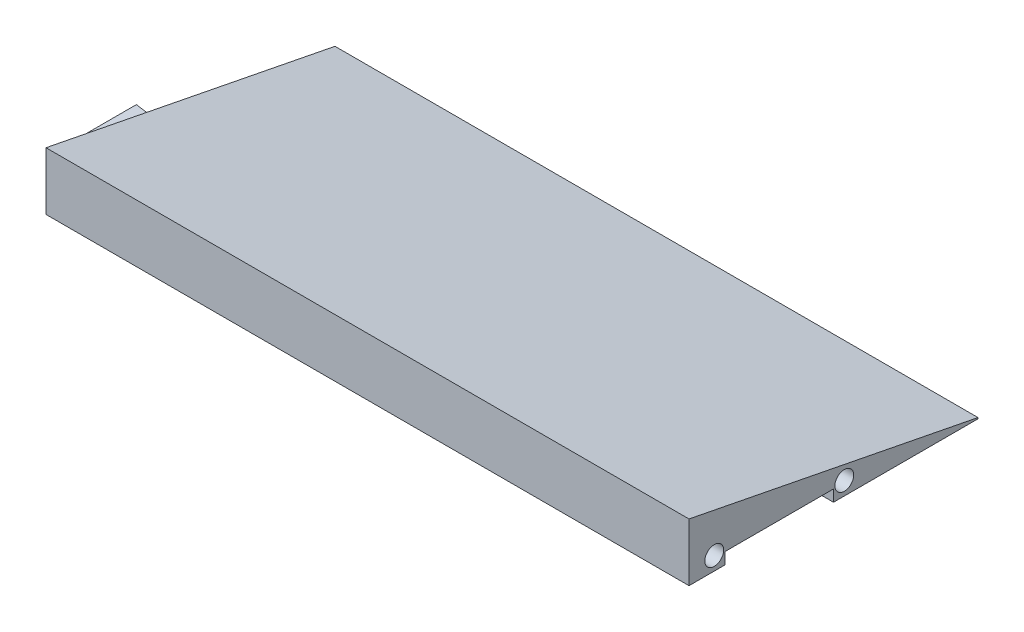
from build123d import *

# Parameters (mm, degrees)
BOSS_EXTRUDE1_DEPTH = 195.58
SKETCH2_R           = 3.3147
CUT_EXTRUDE1_DEPTH  = 38.1
SKETCH3_W           = 38.1
SKETCH3_H           = 4.064
CUT_EXTRUDE2_DEPTH  = 405.649982083
CUT_EXTRUDE3_DEPTH  = 4.064
SKETCH5_W           = 101.6
SKETCH5_H           = 20.32
CUT_EXTRUDE4_DEPTH  = 165.1
BOSS_EXTRUDE2_DEPTH = 4.064
SKETCH7_R           = 1.905
CUT_EXTRUDE5_DEPTH  = 12.7


with BuildPart() as part:
    # Sketch1 → Boss-Extrude1 (new, symmetric)
    with BuildSketch(Plane(origin=(0, 0, 0), x_dir=(0, 0, -1), z_dir=(1, 0, 0))):
        Polygon((0, 0), (0, 20.32), (101.6, 0.4), (101.6, 0), align=None)
    extrude(amount=BOSS_EXTRUDE1_DEPTH, both=True)

    # Sketch2 → Cut-Extrude1 (cut)
    with BuildSketch(Plane(origin=(195.58, 0, 0), x_dir=(0, 0, -1), z_dir=(1, 0, 0))):
        with Locations((8.876362872, 4.7625)):
            Circle(SKETCH2_R)
        with Locations((54.596362872, 4.7625)):
            Circle(SKETCH2_R)
    cut_extrude1 = extrude(amount=-CUT_EXTRUDE1_DEPTH, mode=Mode.SUBTRACT)

    # Mirror3: Cut-Extrude1 across plane
    add(cut_extrude1.mirror(Plane(origin=(0, 0, 0), x_dir=(0, 0, 1), z_dir=(1, 0, 0))), mode=Mode.SUBTRACT)

    # Sketch3 → Cut-Extrude2 (cut, through all)
    with BuildSketch(Plane.ZY.offset(195.58)):
        with Locations((-31.75, 2.032)):
            Rectangle(SKETCH3_W, SKETCH3_H)
    extrude(amount=-CUT_EXTRUDE2_DEPTH, mode=Mode.SUBTRACT)

    # Sketch4 → Cut-Extrude3 (cut)
    with BuildSketch(Plane.XZ):
        Polygon((-10.28091728, -50.8), (-11.606541067, -60.232303355), (-10.28091728, -60.232303355), (5.914635147, -60.232303355), (7.240258933, -60.232303355), (5.914635147, -50.8), align=None)
        Polygon((56.917835147, -50.8), (55.59221136, -60.232303355), (56.917835147, -60.232303355), (73.113387573, -60.232303355), (74.43901136, -60.232303355), (73.113387573, -50.8), align=None)
        Polygon((124.116587573, -50.8), (122.790963787, -60.232303355), (124.116587573, -60.232303355), (140.31214, -60.232303355), (141.637763787, -60.232303355), (140.31214, -50.8), align=None)
        Polygon((124.116587573, -12.7), (140.31214, -12.7), (141.637763787, -3.267696645), (140.31214, -3.267696645), (124.116587573, -3.267696645), (122.790963787, -3.267696645), align=None)
        Polygon((56.917835147, -12.7), (73.113387573, -12.7), (74.43901136, -3.267696645), (73.113387573, -3.267696645), (56.917835147, -3.267696645), (55.59221136, -3.267696645), align=None)
        Polygon((-10.28091728, -12.7), (5.914635147, -12.7), (7.240258933, -3.267696645), (5.914635147, -3.267696645), (-10.28091728, -3.267696645), (-11.606541067, -3.267696645), align=None)
    extrude(amount=-CUT_EXTRUDE3_DEPTH, mode=Mode.SUBTRACT)

    # Sketch5 → Cut-Extrude4 (cut)
    with BuildSketch(Plane.ZY.offset(195.58)):
        with Locations((-50.8, 10.16)):
            Rectangle(SKETCH5_W, SKETCH5_H)
    extrude(amount=-CUT_EXTRUDE4_DEPTH, mode=Mode.SUBTRACT)

    # Sketch6 → Boss-Extrude2 (add)
    with BuildSketch(Plane.XZ.offset(-4.064)):
        Polygon((-30.48, -23.495), (-30.48, -39.893752427), (-39.912303355, -41.219376213), (-39.912303355, -22.169376213), align=None)
    extrude(amount=-BOSS_EXTRUDE2_DEPTH)

    # Sketch7 → Cut-Extrude5 (cut)
    with BuildSketch(Plane.ZY.offset(30.48)):
        with Locations((-15.24, 8.128)):
            Circle(SKETCH7_R)
        with Locations((-45.72, 8.128)):
            Circle(SKETCH7_R)
    extrude(amount=-CUT_EXTRUDE5_DEPTH, mode=Mode.SUBTRACT)


solid = part.part
